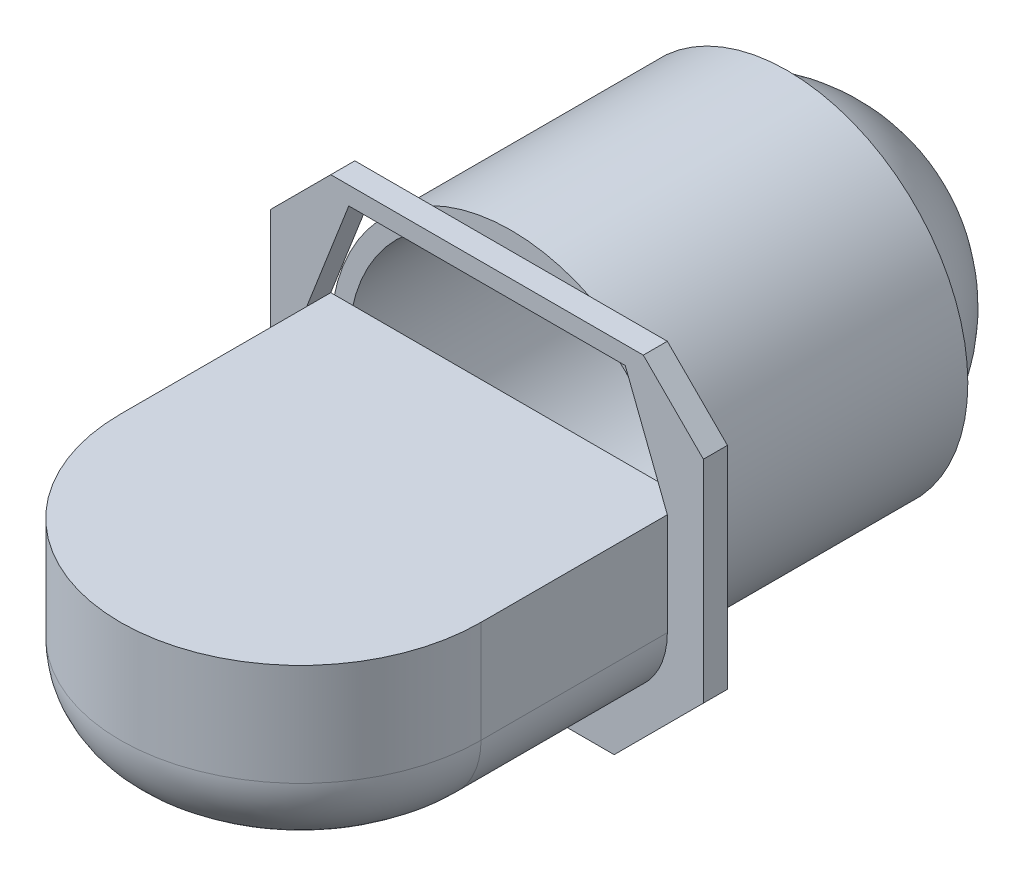
from build123d import *

# Parameters (mm, degrees)
SKETCH1_R                = 30
SKETCH1_R_2              = 27
BOSS_EXTRUDE1_DEPTH      = 46
BOSS_EXTRUDE2_DEPTH      = 6
BOSS_EXTRUDE2_DEPTH_BACK = 24
FILLET1_R                = 13
BOSS_EXTRUDE7_DEPTH      = 4


with BuildPart() as part:
    # Sketch1 → Boss-Extrude1 (new body)
    with BuildSketch(Plane.XY):
        Circle(SKETCH1_R)
        Circle(SKETCH1_R_2, mode=Mode.SUBTRACT)
    extrude(amount=BOSS_EXTRUDE1_DEPTH)


with BuildPart() as body_2:
    # Sketch3 → Revolve1 (revolve)
    with BuildSketch(Plane(origin=(0, 0, 0), x_dir=(1, 0, 0), z_dir=(0, 1, 0))):
        with BuildLine():
            Line((27, 0), (0, 0))
            Line((0, 0), (0, 20))
            ThreePointArc((0, 20), (16.800297616, 14.455401782), (27, 0))
        make_face()
    revolve(axis=Axis((0, 0, -24.323945347), (0, 0, 1)))


with BuildPart() as body_3:
    # Sketch5 → Boss-Extrude2 (new, two sides: drawn at the far end of the back side and taken through both)
    with BuildSketch(Plane(origin=(0, 0, 0), x_dir=(1, 0, 0), z_dir=(0, 1, 0)).offset(-BOSS_EXTRUDE2_DEPTH_BACK)):
        with BuildLine():
            Line((-30, -46), (-30, -81))
            ThreePointArc((-30, -81), (0, -111), (30, -81))
            Line((30, -81), (30, -46))
            Line((30, -46), (-30, -46))
        make_face()
    extrude(amount=BOSS_EXTRUDE2_DEPTH + BOSS_EXTRUDE2_DEPTH_BACK)

    # Fillet1
    fillet1_edges = [body_3.edges().sort_by_distance(p)[0] for p in [
        (30, -24, 63.5),
        (0, -24, 111),
        (-30, -24, 63.5),
    ]]
    fillet(fillet1_edges, radius=FILLET1_R)

    # Sketch7 → Boss-Extrude7 (add)
    with BuildSketch(Plane.XY.offset(46)):
        Polygon((-36, 17), (-36, -18.150757595), (-21.150757595, -33), (21.150757595, -33), (36, -18.150757595), (36, 17), (26, 27), (-26, 27), align=None)
        Polygon((-30, 6), (30, 6), (23, 24), (-23, 24), align=None, mode=Mode.SUBTRACT)
    extrude(amount=BOSS_EXTRUDE7_DEPTH)


solid = Compound([part.part, body_2.part, body_3.part])
